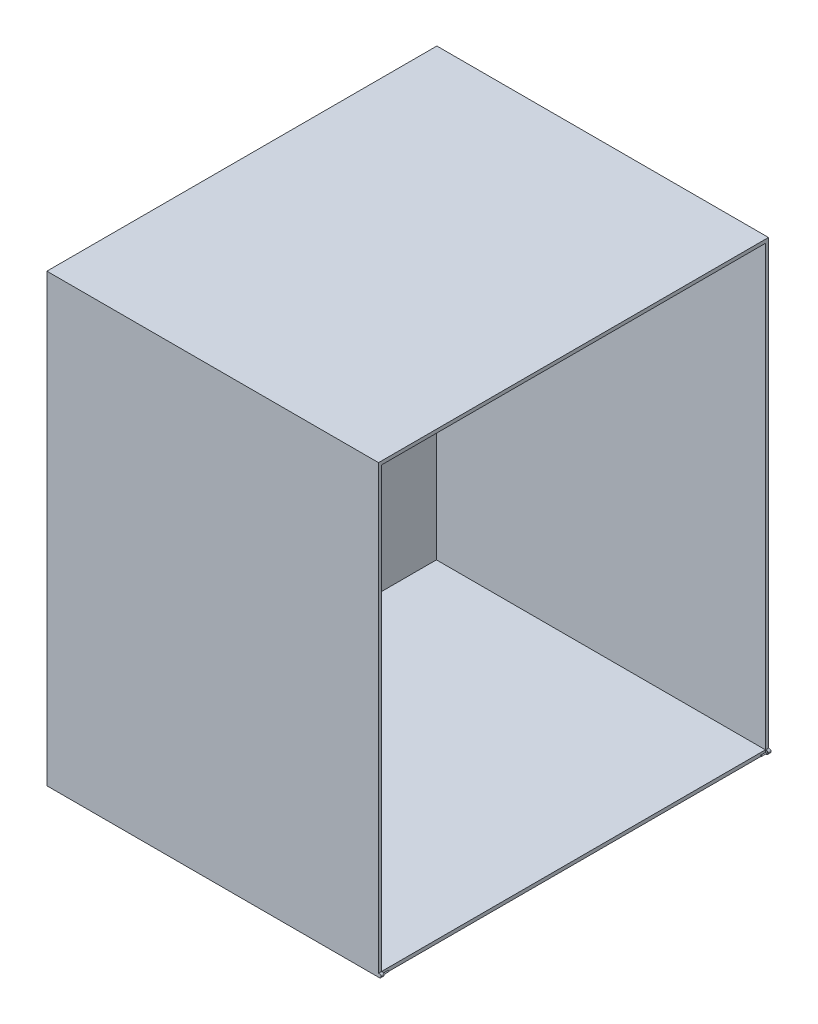
from build123d import *

# Parameters (mm, degrees)
SKETCH1_W            = 604.8
SKETCH1_H            = 711.2
BOSS_EXTRUDE1_DEPTH  = 812.8
SKETCH2_W            = 700
SKETCH2_H            = 800
BOSS_EXTRUDE2_DEPTH  = 600
SKETCH2_2_W          = 700
SKETCH2_2_H          = 800
CUT_EXTRUDE1_DEPTH   = 600
SKETCH3_W            = 5.6
SKETCH3_H            = 6.4
BOSS_EXTRUDE3_DEPTH  = 4.8
FILLET1_R            = 3.2
SKETCH4_R            = 1
BOSS_EXTRUDE4_DEPTH  = 10
FILLET1_OF_MIRROR1_R = 3.2


with BuildPart() as part:
    # Sketch1 → Boss-Extrude1 (new body)
    with BuildSketch(Plane(origin=(0, 0, 0), x_dir=(1, 0, 0), z_dir=(0, 1, 0))):
        Rectangle(SKETCH1_W, SKETCH1_H)
    extrude(amount=BOSS_EXTRUDE1_DEPTH)

    # Sketch2 → Boss-Extrude2 (add)
    with BuildSketch(Plane(origin=(302.4, 0, 0), x_dir=(0, 0, -1), z_dir=(1, 0, 0))):
        with Locations((0, 406.4)):
            Rectangle(SKETCH2_W, SKETCH2_H)
    extrude(amount=-BOSS_EXTRUDE2_DEPTH)

    # Sketch2<2> → Cut-Extrude1 (cut)
    with BuildSketch(Plane(origin=(302.4, 0, 0), x_dir=(0, 0, -1), z_dir=(1, 0, 0))):
        with Locations((0, 406.4)):
            Rectangle(SKETCH2_2_W, SKETCH2_2_H)
    extrude(amount=-CUT_EXTRUDE1_DEPTH, mode=Mode.SUBTRACT)

    # Sketch3 → Boss-Extrude3 (add)
    with BuildSketch(Plane(origin=(302.4, 0, 0), x_dir=(0, 0, -1), z_dir=(1, 0, 0))):
        with Locations((-352.8, 3.2)):
            Rectangle(SKETCH3_W, SKETCH3_H)
    boss_extrude3 = extrude(amount=BOSS_EXTRUDE3_DEPTH)

    # Fillet1
    fillet1_edges = [part.edges().sort_by_distance(p)[0] for p in [
        (307.2, 0, 352.8),
        (307.2, 6.4, 352.8),
    ]]
    fillet(fillet1_edges, radius=FILLET1_R - 0.0001)  # a hair under: the kernel refuses the full size

    # Sketch4 → Boss-Extrude4 (add)
    with BuildSketch(Plane(origin=(0, 0, 350), x_dir=(-1, 0, 0), z_dir=(0, 0, -1))):
        with Locations(Location((-304.8, 3.2, 0), (0, 0, 180))):
            Circle(SKETCH4_R)
    boss_extrude4 = extrude(amount=BOSS_EXTRUDE4_DEPTH)

    # Mirror1: Boss-Extrude3, Boss-Extrude4 across plane
    add(boss_extrude3.mirror(Plane.XY))
    add(boss_extrude4.mirror(Plane.XY))

    # Fillet1 of Mirror1
    fillet1_of_mirror1_edges = [part.edges().sort_by_distance(p)[0] for p in [
        (307.2, 0, -352.8),
        (307.2, 6.4, -352.8),
    ]]
    fillet(fillet1_of_mirror1_edges, radius=FILLET1_OF_MIRROR1_R - 0.0001)  # a hair under: the kernel refuses the full size


solid = part.part
